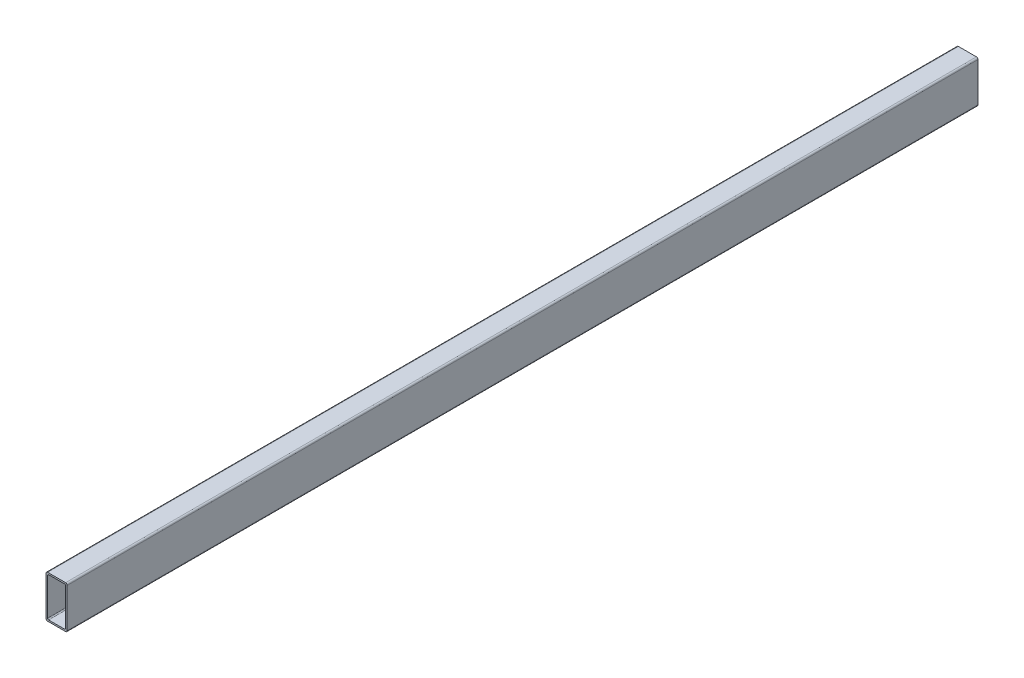
from build123d import *

# Parameters (mm, degrees)
EXTRUDE_1_DEPTH = 430


# Read off the part's stored shape, not the designer's step: Бобышка-Вытянуть1
with BuildPart() as part:
    # Бобышка-Вытянуть1 outline → Бобышка-Вытянуть1 (new body)
    with BuildSketch(Plane.XY):
        with BuildLine():
            Line((0, 1.5), (0, 38.5))
            ThreePointArc((0, 38.5), (-0.439339828, 39.560660172), (-1.5, 40))
            Line((-1.5, 40), (-18.5, 40))
            ThreePointArc((-18.5, 40), (-19.560660172, 39.560660172), (-20, 38.5))
            Line((-20, 38.5), (-20, 1.5))
            ThreePointArc((-20, 1.5), (-19.560660172, 0.439339828), (-18.5, 0))
            Line((-18.5, 0), (-1.5, 0))
            ThreePointArc((-1.5, 0), (-0.439339828, 0.439339828), (0, 1.5))
        make_face()
        with BuildLine():
            ThreePointArc((-1.5, 2.5), (-1.792893219, 1.792893219), (-2.5, 1.5))
            Line((-2.5, 1.5), (-17.5, 1.5))
            ThreePointArc((-17.5, 1.5), (-18.207106781, 1.792893219), (-18.5, 2.5))
            Line((-18.5, 2.5), (-18.5, 37.5))
            ThreePointArc((-18.5, 37.5), (-18.207106781, 38.207106781), (-17.5, 38.5))
            Line((-17.5, 38.5), (-2.5, 38.5))
            ThreePointArc((-2.5, 38.5), (-1.792893219, 38.207106781), (-1.5, 37.5))
            Line((-1.5, 37.5), (-1.5, 2.5))
        make_face(mode=Mode.SUBTRACT)
    extrude(amount=EXTRUDE_1_DEPTH)

    # Зеркальное отражение1: part across plane


with BuildPart() as part_1:
    add(part.part)
    add(part.part.mirror(Plane(origin=(-1.5, 38.5, 0), x_dir=(1, 0, 0), z_dir=(0, 0, -1))))


solid = part_1.part
